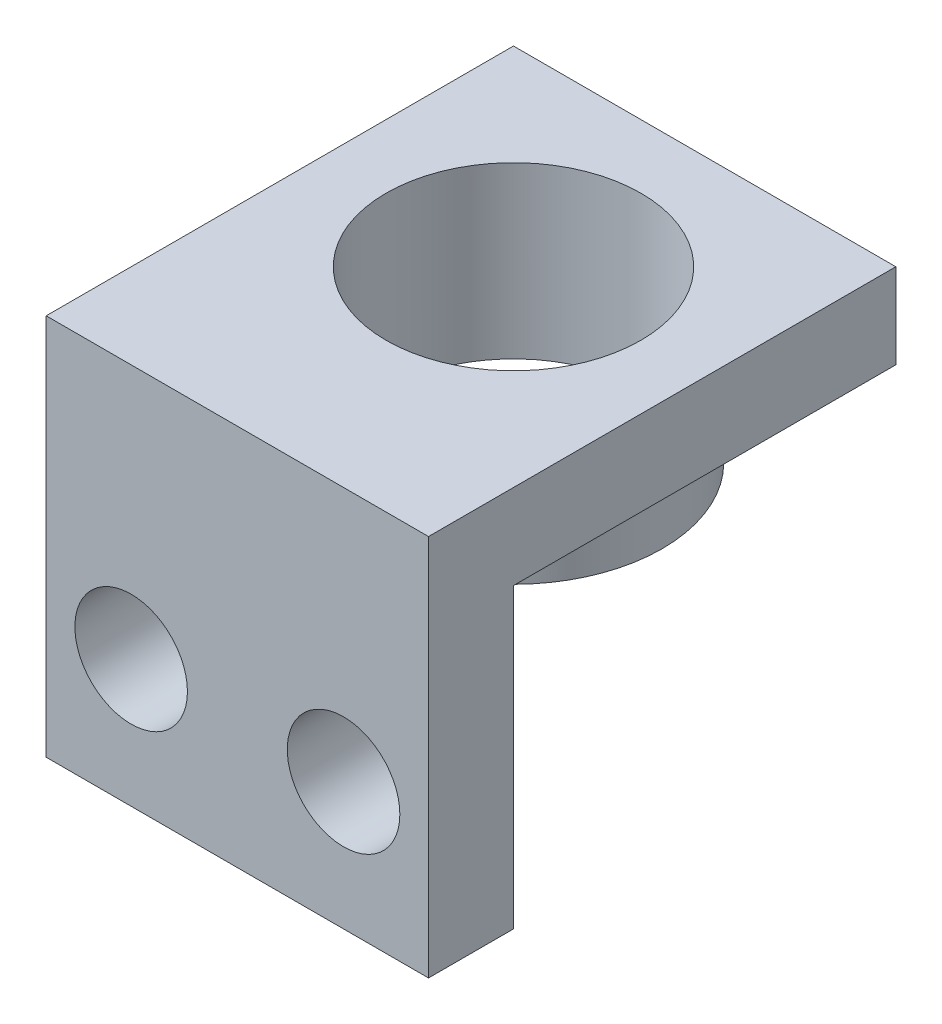
from build123d import *

# Parameters (mm, degrees)
SKETCH1_W           = 18
SKETCH1_H           = 18
SKETCH1_R           = 6
BOSS_EXTRUDE1_DEPTH = 4
SKETCH2_W           = 18
SKETCH2_H           = 18
SKETCH2_R           = 2.65
BOSS_EXTRUDE2_DEPTH = 4
BOSS_EXTRUDE3_START = 4
SKETCH3_R           = 7
SKETCH3_R_2         = 6
BOSS_EXTRUDE3_DEPTH = 4


with BuildPart() as part:
    # Sketch1 → Boss-Extrude1 (new body)
    with BuildSketch(Plane(origin=(0, 0, 0), x_dir=(1, 0, 0), z_dir=(0, 1, 0))):
        with Locations((9, 9)):
            Rectangle(SKETCH1_W, SKETCH1_H)
        with Locations((9, 9)):
            Circle(SKETCH1_R, mode=Mode.SUBTRACT)
    extrude(amount=BOSS_EXTRUDE1_DEPTH)

    # Sketch2 → Boss-Extrude2 (add)
    with BuildSketch(Plane.XY):
        with Locations((9, -5)):
            Rectangle(SKETCH2_W, SKETCH2_H)
        with Locations((4, -8)):
            Circle(SKETCH2_R, mode=Mode.SUBTRACT)
        with Locations((14, -8)):
            Circle(SKETCH2_R, mode=Mode.SUBTRACT)
    extrude(amount=BOSS_EXTRUDE2_DEPTH)

    # Sketch3 → Boss-Extrude3 (add)
    with BuildSketch(Plane.XZ.offset(BOSS_EXTRUDE3_START)):
        with Locations((9, -9)):
            Circle(SKETCH3_R)
        with Locations((9, -9)):
            Circle(SKETCH3_R_2, mode=Mode.SUBTRACT)
    extrude(amount=-BOSS_EXTRUDE3_DEPTH)


solid = part.part
